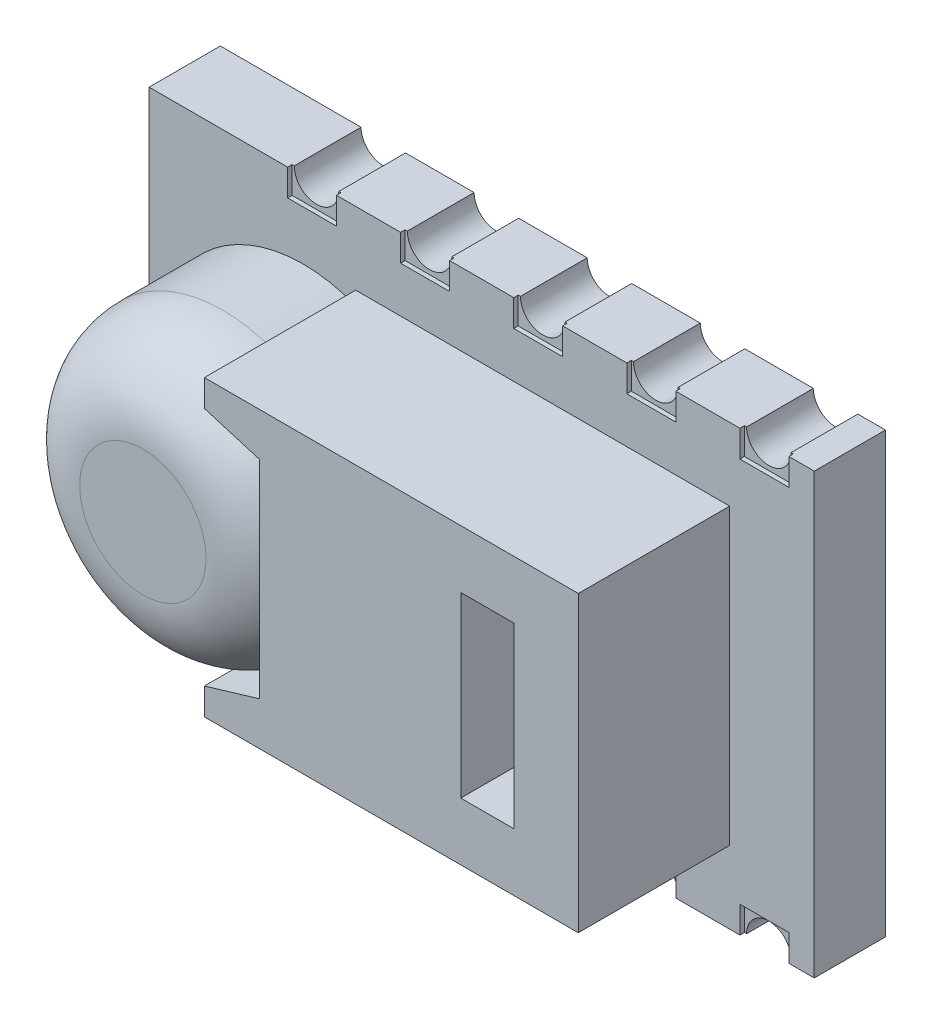
from build123d import *

# Parameters (mm, degrees)
SKETCH1_W               = 7.47
SKETCH1_H               = 4.93
BOSS_EXTRUDE1_DEPTH     = 0.8
BOSS_EXTRUDE2_DEPTH     = 1.7
SKETCH3_R               = 1.609625666
BOSS_EXTRUDE3_DEPTH     = 1.8
FILLET1_R               = 0.9
SKETCH4_W               = 0.6
SKETCH4_H               = 2
CUT_EXTRUDE1_DEPTH      = 1.8
CUT_EXTRUDE2_DEPTH      = 10.129392113
SKETCH6_W               = 0.55
SKETCH6_H               = 0.3
CUT_EXTRUDE3_DEPTH      = 0.05
LPATTERN1_COUNT         = 5
LPATTERN1_PITCH         = 1.27
MIRROR1_COPY_1_DEPTH    = 10.129392113
MIRROR1_COPY_2_DEPTH    = 10.129392113
MIRROR1_COPY_3_DEPTH    = 10.129392113
MIRROR1_COPY_4_DEPTH    = 10.129392113
MIRROR1_COPY_5_SKETCH_W = 0.55
MIRROR1_COPY_5_SKETCH_H = 0.3
MIRROR1_COPY_5_DEPTH    = 0.05
MIRROR1_COPY_6_SKETCH_W = 0.55
MIRROR1_COPY_6_SKETCH_H = 0.3
MIRROR1_COPY_6_DEPTH    = 0.05
MIRROR1_COPY_7_SKETCH_W = 0.55
MIRROR1_COPY_7_SKETCH_H = 0.3
MIRROR1_COPY_7_DEPTH    = 0.05
MIRROR1_COPY_8_SKETCH_W = 0.55
MIRROR1_COPY_8_SKETCH_H = 0.3
MIRROR1_COPY_8_DEPTH    = 0.05


with BuildPart() as part:
    # Sketch1 → Boss-Extrude1 (new body)
    with BuildSketch(Plane.XY):
        with Locations((3.735, 2.465)):
            Rectangle(SKETCH1_W, SKETCH1_H)
    extrude(amount=BOSS_EXTRUDE1_DEPTH)

    # Sketch2 → Boss-Extrude2 (add)
    with BuildSketch(Plane.XY.offset(0.8)):
        Polygon((2.939618782, 3.62939168), (2.939618782, 1.30060832), (2.32, 1.115), (2.32, 0.815), (6.52, 0.815), (6.52, 4.115), (2.32, 4.115), (2.32, 3.815), align=None)
    extrude(amount=BOSS_EXTRUDE2_DEPTH)

    # Sketch3 → Boss-Extrude3 (add)
    with BuildSketch(Plane.XY.offset(0.8)):
        with Locations(Location((1.729625666, 2.465, 0), (0, 0, 68.482991379))):
            Circle(SKETCH3_R)
    extrude(amount=BOSS_EXTRUDE3_DEPTH)

    # Fillet1
    # the kernel refuses this fillet: 0.9 mm, written as the material it takes off along each edge
    with BuildSketch(Plane(origin=(1.729625666, 2.465, 2.6), x_dir=(0.3667774110162909, 0.9303087287391142, 0), z_dir=(0.9303087287391142, -0.3667774110162909, 0))) as fillet1_piece_1_section:
        with BuildLine():
            CenterArc((1.609625666 - FILLET1_R, -FILLET1_R), FILLET1_R, 0, 90)
            Line((1.609625666 - FILLET1_R, 0), (1.609625666, 0))
            Line((1.609625666, 0), (1.609625666, -FILLET1_R))
        make_face()
    fillet1_piece_1 = revolve(axis=Axis((1.729625666, 2.465, 2.6), (0, 0, 1)), mode=Mode.PRIVATE)
    fillet1_piece_1 = split(fillet1_piece_1, bisect_by=Plane(origin=(2.32, 3.98462035, 2.239901454), z_dir=(-1, 0, 0)), keep=Keep.TOP, mode=Mode.PRIVATE)
    add(fillet1_piece_1, mode=Mode.SUBTRACT)
    with BuildSketch(Plane(origin=(1.729625666, 2.465, 2.6), x_dir=(0.3667774110162909, 0.9303087287391142, 0), z_dir=(0.9303087287391142, -0.3667774110162909, 0))) as fillet1_piece_2_section:
        with BuildLine():
            CenterArc((1.609625666 - FILLET1_R, -FILLET1_R), FILLET1_R, 0, 90)
            Line((1.609625666 - FILLET1_R, 0), (1.609625666, 0))
            Line((1.609625666, 0), (1.609625666, -FILLET1_R))
        make_face()
    fillet1_piece_2 = revolve(axis=Axis((1.729625666, 2.465, 2.6), (0, 0, 1)), mode=Mode.PRIVATE)
    fillet1_piece_2 = split(fillet1_piece_2, bisect_by=Plane(origin=(2.8939742, 1.286935374, 1.864268615), z_dir=(-0.28695452749278183, 0.9579442046128753, 0)), keep=Keep.TOP, mode=Mode.PRIVATE)
    fillet1_piece_2 = split(fillet1_piece_2, bisect_by=Plane(origin=(2.939618782, 1.348625417, 1.864268615), z_dir=(-1, 0, 0)), keep=Keep.TOP, mode=Mode.PRIVATE)
    fillet1_piece_2 = split(fillet1_piece_2, bisect_by=Plane(origin=(3.507726639, 3.459213583, 1.864268615), z_dir=(-0.28695452749278183, -0.9579442046128753, 0)), keep=Keep.TOP, mode=Mode.PRIVATE)
    add(fillet1_piece_2, mode=Mode.SUBTRACT)
    with BuildSketch(Plane(origin=(1.729625666, 2.465, 2.6), x_dir=(0.3667774110162909, 0.9303087287391142, 0), z_dir=(0.9303087287391142, -0.3667774110162909, 0))) as fillet1_piece_3_section:
        with BuildLine():
            CenterArc((1.609625666 - FILLET1_R, -FILLET1_R), FILLET1_R, 0, 90)
            Line((1.609625666 - FILLET1_R, 0), (1.609625666, 0))
            Line((1.609625666, 0), (1.609625666, -FILLET1_R))
        make_face()
    fillet1_piece_3 = revolve(axis=Axis((1.729625666, 2.465, 2.6), (0, 0, 1)), mode=Mode.PRIVATE)
    fillet1_piece_3 = split(fillet1_piece_3, bisect_by=Plane(origin=(2.494750344, 3.818777252, 2.5), z_dir=(0, 0, 1)), keep=Keep.TOP, mode=Mode.PRIVATE)
    add(fillet1_piece_3, mode=Mode.SUBTRACT)

    # Sketch4 → Cut-Extrude1 (cut)
    with BuildSketch(Plane.XY.offset(2.5)):
        with Locations((5.5, 2.465)):
            Rectangle(SKETCH4_W, SKETCH4_H)
    extrude(amount=-CUT_EXTRUDE1_DEPTH, mode=Mode.SUBTRACT)

    # Sketch5 → Cut-Extrude2 (cut, through all)
    with BuildSketch(Plane.XY.offset(0.8)):
        with BuildLine():
            Line((1.58, 4.93), (2.08, 4.93))
            ThreePointArc((2.08, 4.93), (1.83, 4.68), (1.58, 4.93))
        make_face()
    cut_extrude2 = extrude(amount=-CUT_EXTRUDE2_DEPTH, mode=Mode.SUBTRACT)

    # Sketch6 → Cut-Extrude3 (cut)
    with BuildSketch(Plane.XY.offset(0.8)):
        with Locations((1.83, 4.78)):
            Rectangle(SKETCH6_W, SKETCH6_H)
    cut_extrude3 = extrude(amount=-CUT_EXTRUDE3_DEPTH, mode=Mode.SUBTRACT)

    # LPattern1: Cut-Extrude2, Cut-Extrude3 ×5
    with Locations(*[(i * LPATTERN1_PITCH, 0, 0) for i in range(1, LPATTERN1_COUNT)]):
        add(cut_extrude2, mode=Mode.SUBTRACT)
        add(cut_extrude3, mode=Mode.SUBTRACT)

    # Mirror1: Cut-Extrude2, Cut-Extrude3 across plane
    add(cut_extrude2.mirror(Plane.ZX.offset(2.465)), mode=Mode.SUBTRACT)
    add(cut_extrude3.mirror(Plane.ZX.offset(2.465)), mode=Mode.SUBTRACT)

    # Mirror1 copy 1 sketch → Mirror1 copy 1 (cut, through all)
    with BuildSketch(Plane(origin=(1.27, 4.93, 0.8), x_dir=(1, 0, 0), z_dir=(0, 0, 1))):
        with BuildLine():
            Line((1.58, -4.93), (2.08, -4.93))
            ThreePointArc((2.08, -4.93), (1.83, -4.68), (1.58, -4.93))
        make_face()
    extrude(amount=-MIRROR1_COPY_1_DEPTH, mode=Mode.SUBTRACT)

    # Mirror1 copy 2 sketch → Mirror1 copy 2 (cut, through all)
    with BuildSketch(Plane(origin=(2.54, 4.93, 0.8), x_dir=(1, 0, 0), z_dir=(0, 0, 1))):
        with BuildLine():
            Line((1.58, -4.93), (2.08, -4.93))
            ThreePointArc((2.08, -4.93), (1.83, -4.68), (1.58, -4.93))
        make_face()
    extrude(amount=-MIRROR1_COPY_2_DEPTH, mode=Mode.SUBTRACT)

    # Mirror1 copy 3 sketch → Mirror1 copy 3 (cut, through all)
    with BuildSketch(Plane(origin=(3.81, 4.93, 0.8), x_dir=(1, 0, 0), z_dir=(0, 0, 1))):
        with BuildLine():
            Line((1.58, -4.93), (2.08, -4.93))
            ThreePointArc((2.08, -4.93), (1.83, -4.68), (1.58, -4.93))
        make_face()
    extrude(amount=-MIRROR1_COPY_3_DEPTH, mode=Mode.SUBTRACT)

    # Mirror1 copy 4 sketch → Mirror1 copy 4 (cut, through all)
    with BuildSketch(Plane(origin=(5.08, 4.93, 0.8), x_dir=(1, 0, 0), z_dir=(0, 0, 1))):
        with BuildLine():
            Line((1.58, -4.93), (2.08, -4.93))
            ThreePointArc((2.08, -4.93), (1.83, -4.68), (1.58, -4.93))
        make_face()
    extrude(amount=-MIRROR1_COPY_4_DEPTH, mode=Mode.SUBTRACT)

    # Mirror1 copy 5 sketch → Mirror1 copy 5 (cut)
    with BuildSketch(Plane(origin=(1.27, 4.93, 0.8), x_dir=(1, 0, 0), z_dir=(0, 0, 1))):
        with Locations((1.83, -4.78)):
            Rectangle(MIRROR1_COPY_5_SKETCH_W, MIRROR1_COPY_5_SKETCH_H)
    extrude(amount=-MIRROR1_COPY_5_DEPTH, mode=Mode.SUBTRACT)

    # Mirror1 copy 6 sketch → Mirror1 copy 6 (cut)
    with BuildSketch(Plane(origin=(2.54, 4.93, 0.8), x_dir=(1, 0, 0), z_dir=(0, 0, 1))):
        with Locations((1.83, -4.78)):
            Rectangle(MIRROR1_COPY_6_SKETCH_W, MIRROR1_COPY_6_SKETCH_H)
    extrude(amount=-MIRROR1_COPY_6_DEPTH, mode=Mode.SUBTRACT)

    # Mirror1 copy 7 sketch → Mirror1 copy 7 (cut)
    with BuildSketch(Plane(origin=(3.81, 4.93, 0.8), x_dir=(1, 0, 0), z_dir=(0, 0, 1))):
        with Locations((1.83, -4.78)):
            Rectangle(MIRROR1_COPY_7_SKETCH_W, MIRROR1_COPY_7_SKETCH_H)
    extrude(amount=-MIRROR1_COPY_7_DEPTH, mode=Mode.SUBTRACT)

    # Mirror1 copy 8 sketch → Mirror1 copy 8 (cut)
    with BuildSketch(Plane(origin=(5.08, 4.93, 0.8), x_dir=(1, 0, 0), z_dir=(0, 0, 1))):
        with Locations((1.83, -4.78)):
            Rectangle(MIRROR1_COPY_8_SKETCH_W, MIRROR1_COPY_8_SKETCH_H)
    extrude(amount=-MIRROR1_COPY_8_DEPTH, mode=Mode.SUBTRACT)


solid = part.part
